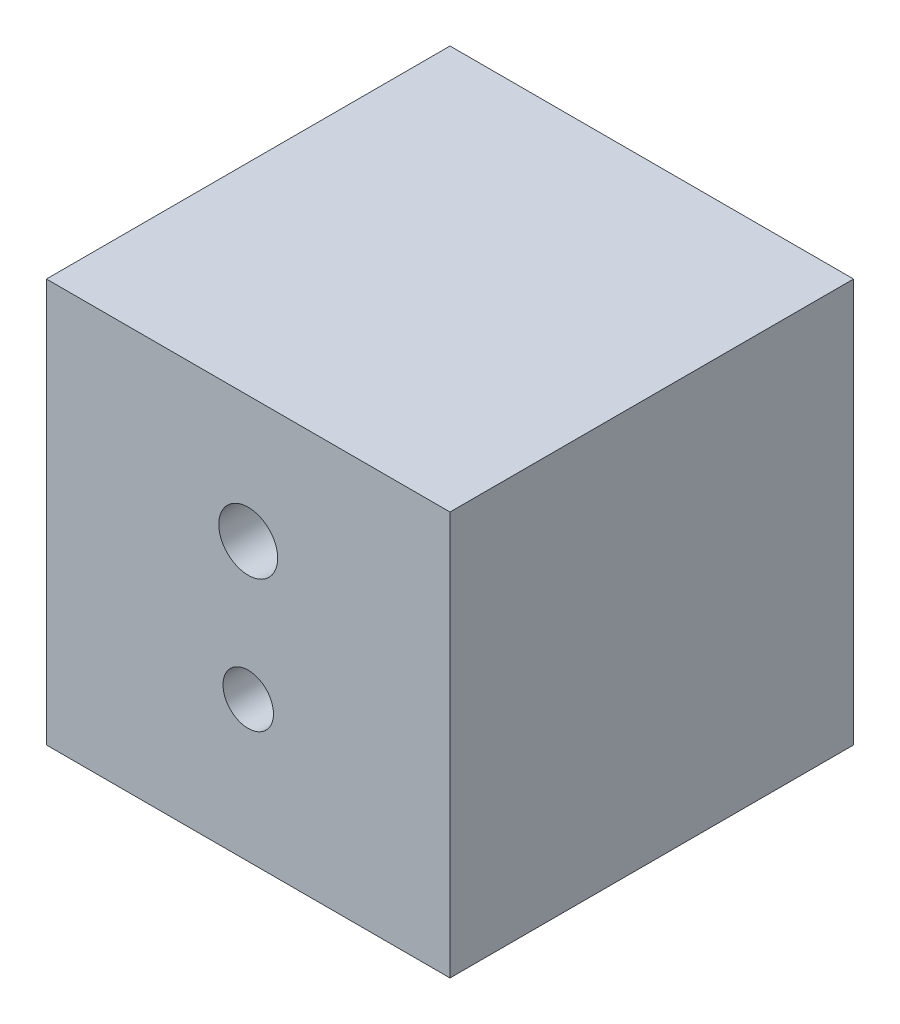
from build123d import *

# Parameters (mm, degrees)
SKETCH2_W           = 76.2
SKETCH2_H           = 76.2
BOSS_EXTRUDE1_DEPTH = 76.2
SKETCH3_R           = 4.7625
SKETCH3_R_2         = 5.5626
CUT_EXTRUDE1_DEPTH  = 72.39


with BuildPart() as part:
    # Sketch2 → Boss-Extrude1 (new body)
    with BuildSketch(Plane(origin=(0, 0, 0), x_dir=(1, 0, 0), z_dir=(0, 1, 0))):
        Rectangle(SKETCH2_W, SKETCH2_H)
    extrude(amount=BOSS_EXTRUDE1_DEPTH)

    # Sketch3 → Cut-Extrude1 (cut)
    with BuildSketch(Plane.XY.offset(38.1)):
        with Locations((0, 26.522528218)):
            Circle(SKETCH3_R)
        with Locations((0, 52.367028218)):
            Circle(SKETCH3_R_2)
    extrude(amount=-CUT_EXTRUDE1_DEPTH, mode=Mode.SUBTRACT)


solid = part.part
